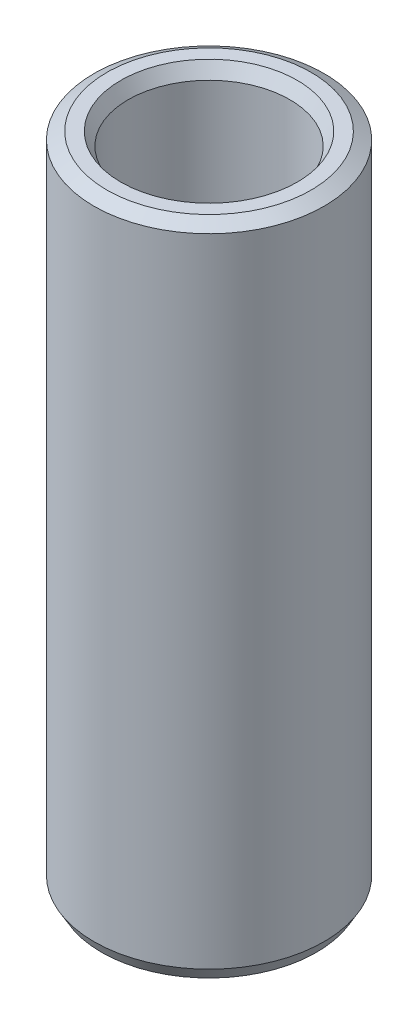
from build123d import *
from OCP.BRepFilletAPI import BRepFilletAPI_MakeChamfer

# Parameters (mm, degrees)
SKETCH1_R           = 35
BOSS_EXTRUDE1_DEPTH = 200.01795172
SKETCH2_R           = 24.572610284
CUT_EXTRUDE1_DEPTH  = 207.051403806
CHAMFER1_SIZE       = 2.274477069
CHAMFER1_SIZE2      = 3.939509844


with BuildPart() as part:
    # Sketch1 → Boss-Extrude1 (new body)
    with BuildSketch(Plane(origin=(0, 0, 0), x_dir=(1, 0, 0), z_dir=(0, 1, 0))):
        Circle(SKETCH1_R)
    extrude(amount=BOSS_EXTRUDE1_DEPTH)

    # Sketch2 → Cut-Extrude1 (cut, through all)
    with BuildSketch(Plane(origin=(0, 0, 0), x_dir=(1, 0, 0), z_dir=(0, 1, 0))):
        Circle(SKETCH2_R)
    extrude(amount=CUT_EXTRUDE1_DEPTH, mode=Mode.SUBTRACT)

    # Chamfer1: one chamfer whose edges measure the first distance from different faces: ONE call of the kernel's chamfer builder (chamfer() names one face for all edges)
    chamfer1_edges_1 = [part.edges().sort_by_distance(p)[0] for p in [
        (-24.572610284, 200.01795172, 0),
    ]]
    chamfer1_side_1 = [part.faces().sort_by_distance(p)[0] for p in [
        (-34.010050506, 200.01795172, 0),
    ]]
    chamfer1_edges_2 = [part.edges().sort_by_distance(p)[0] for p in [
        (-24.572610284, 0, 0),
    ]]
    chamfer1_side_2 = [part.faces().sort_by_distance(p)[0] for p in [
        (-24.572610284, 100.00897586, 0),
    ]]
    chamfer1_edges_3 = [part.edges().sort_by_distance(p)[0] for p in [
        (-35, 0, 0),
    ]]
    chamfer1_side_3 = [part.faces().sort_by_distance(p)[0] for p in [
        (-34.010050506, 0, 0),
    ]]
    chamfer1_edges_4 = [part.edges().sort_by_distance(p)[0] for p in [
        (-35, 200.01795172, 0),
    ]]
    chamfer1_side_4 = [part.faces().sort_by_distance(p)[0] for p in [
        (-35, 100.00897586, 0),
    ]]
    chamfer1 = BRepFilletAPI_MakeChamfer(part.part.solid().wrapped)
    for e in chamfer1_edges_1:
        chamfer1.Add(CHAMFER1_SIZE, CHAMFER1_SIZE2, e.wrapped, chamfer1_side_1[0].wrapped)  # the first distance lies on this face
    for e in chamfer1_edges_2:
        chamfer1.Add(CHAMFER1_SIZE, CHAMFER1_SIZE2, e.wrapped, chamfer1_side_2[0].wrapped)  # the first distance lies on this face
    for e in chamfer1_edges_3:
        chamfer1.Add(CHAMFER1_SIZE, CHAMFER1_SIZE2, e.wrapped, chamfer1_side_3[0].wrapped)  # the first distance lies on this face
    for e in chamfer1_edges_4:
        chamfer1.Add(CHAMFER1_SIZE, CHAMFER1_SIZE2, e.wrapped, chamfer1_side_4[0].wrapped)  # the first distance lies on this face
    add(Compound.cast(chamfer1.Shape()), mode=Mode.REPLACE)


solid = part.part
